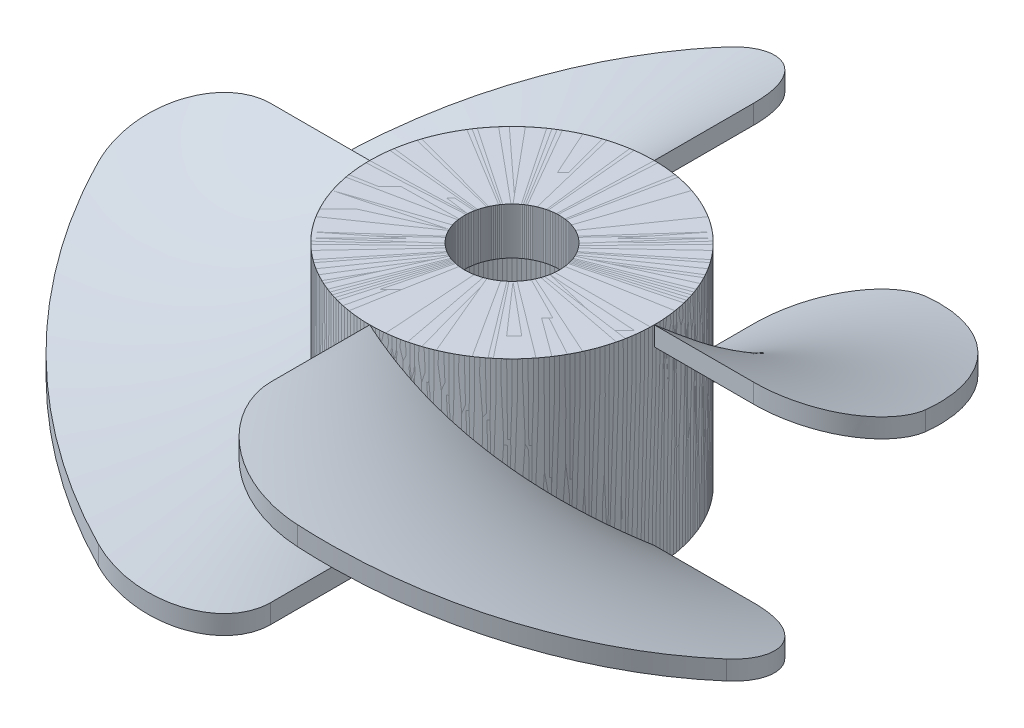
from build123d import *

# Parameters (mm, degrees)
SWEEP2_PITCH            = 80
SWEEP2_HEIGHT           = 20
SWEEP2_RADIUS           = 14.9
SWEEP2_START_ANGLE      = -90
SKETCH10_W              = 19.6
SKETCH10_H              = 2
BOSS_EXTRUDE1_START     = -1
BOSS_EXTRUDE1_DEPTH     = 22
FILLET6_R               = 8
CUT_EXTRUDE1_DEPTH      = 16.1
CUT_EXTRUDE1_DEPTH_BACK = 16.1
SKETCH13_3_R            = 12
SKETCH13_3_R_2          = 4.965
CUT_EXTRUDE3_DEPTH      = 1000
CUT_EXTRUDE3_DEPTH_BACK = 16.1
SKETCH13_4_R            = 4.965
CIRPATTERN1_COUNT       = 4


# Read off the part's stored shape, not the designer's step: Boss-Extrude1
with BuildPart() as part:
    # Sweep2: sweep along a helix
    with BuildLine() as sweep2_path:
        add(Helix(SWEEP2_PITCH, SWEEP2_HEIGHT, SWEEP2_RADIUS, center=(0, 0, 0), direction=(0, 1, 0), lefthand=True, mode=Mode.PRIVATE).rotate(Axis((0, 0, 0), (0, 1, 0)), SWEEP2_START_ANGLE))
    # Sketch10 → Sweep2 (sweep)
    with BuildSketch(Plane.XY):
        with Locations((-24.7, 0)):
            Rectangle(SKETCH10_W, SKETCH10_H)
    sweep(path=sweep2_path.line, is_frenet=True)

    # Boss-Extrude1 outline → Boss-Extrude1 (add)
    with BuildSketch(Plane(origin=(0, 0, 0), x_dir=(1, 0, 0), z_dir=(0, 1, 0)).offset(BOSS_EXTRUDE1_START)):
        with BuildLine():
            ThreePointArc((-14.9, 0), (10.53589104, -10.53589104), (0, 14.9))
            add(Edge.make_bspline(
                [(-14.9, 0), (-14.9, 1.46752191), (-14.613700678, 2.906845798), (-14.327401356, 4.346169686), (-13.765805034, 5.701983142), (-13.204208713, 7.057796598), (-12.388897223, 8.277996472), (-11.573585734, 9.498196346), (-10.53589104, 10.53589104), (-9.498196346, 11.573585734), (-8.277996472, 12.388897223), (-7.057796598, 13.204208713), (-5.701983142, 13.765805034), (-4.346169686, 14.327401356), (-2.906845798, 14.613700678), (-1.46752191, 14.9), (0, 14.9)],
                knots=[0, 0, 0, 0.03125, 0.03125, 0.0625, 0.0625, 0.09375, 0.09375, 0.125, 0.125, 0.15625, 0.15625, 0.1875, 0.1875, 0.21875, 0.21875, 0.25, 0.25, 0.25], degree=2, weights=[1, 0.995184727, 1, 0.995184727, 1, 0.995184727, 1, 0.995184727, 1, 0.995184727, 1, 0.995184727, 1, 0.995184727, 1, 0.995184727, 1]))
        make_face()
    extrude(amount=BOSS_EXTRUDE1_DEPTH)

    # Fillet6
    # the kernel refuses this fillet: 8 mm, written as the material it takes off along each edge
    with BuildSketch(Plane(origin=(-6.8e-08, 47.346838319, -34.499999889), x_dir=(3.4711469403176315e-09, -4.06254940799068e-09, 1.0), z_dir=(-6.750155989720952e-14, -1.0, -4.062549407990446e-09))) as fillet6_piece_1:
        with BuildLine():
            CenterArc((9.236381108, 8), FILLET6_R, 162.42909159, 107.57090841)
            ThreePointArc((1.609628536, 10.415086999), (0.40478119, 5.269367606), (0, 0))
            Line((0, 0), (9.236381108, 0))
        make_face()
    extrude(amount=54.693676478, mode=Mode.SUBTRACT)
    with BuildSketch(Plane(origin=(-34.5, 27.346838237, 0), x_dir=(0.15273449337234152, 3.511030608054098e-15, -0.9882672586574412), z_dir=(0, -1, 0))) as fillet6_piece_2:
        with BuildLine():
            CenterArc((9.316852034, 7.906136934), FILLET6_R, 171.214572142, 107.570908938)
            Line((1.410713965, 9.128012881), (0, 0))
            ThreePointArc((0, 0), (5.26936753, -0.404782189), (10.538735325, 0))
        make_face()
    extrude(amount=54.693676474, mode=Mode.SUBTRACT)

    # Sketch13<3> → Cut-Extrude1 (cut, two sides: drawn at the far end of the back side and taken through both)
    # profile 1 of 2: a face of its own
    with BuildSketch(Plane(origin=(0, 0, 0), x_dir=(1, 0, 0), z_dir=(0, 1, 0)).offset(-CUT_EXTRUDE1_DEPTH_BACK)):
        with Locations(Location((0, 0, 0), (0, 0, 270))):
            Circle(SKETCH13_3_R)
        Circle(SKETCH13_3_R_2, mode=Mode.SUBTRACT)
    # profile 2 of 2: a face of its own
    with BuildSketch(Plane(origin=(0, 0, 0), x_dir=(1, 0, 0), z_dir=(0, 1, 0)).offset(-CUT_EXTRUDE1_DEPTH_BACK)):
        Circle(SKETCH13_3_R_2)
    extrude(amount=CUT_EXTRUDE1_DEPTH + CUT_EXTRUDE1_DEPTH_BACK, mode=Mode.SUBTRACT)

    # Sketch13<4> → Cut-Extrude3 (cut, two sides: drawn at the far end of the back side and taken through both)
    with BuildSketch(Plane(origin=(0, 0, 0), x_dir=(1, 0, 0), z_dir=(0, 1, 0)).offset(-CUT_EXTRUDE3_DEPTH_BACK)):
        with Locations(Location((0, 0, 0), (0, 0, 270))):
            Circle(SKETCH13_4_R)
    extrude(amount=CUT_EXTRUDE3_DEPTH + CUT_EXTRUDE3_DEPTH_BACK, mode=Mode.SUBTRACT)


with BuildPart() as cirpattern1_1:
    # CirPattern1: pattern copy
    add(part.part.rotate(Axis((0, -1, 0), (0, 1, 0)), 1 * 360 / CIRPATTERN1_COUNT))


with BuildPart() as cirpattern1_2:
    # CirPattern1: pattern copy
    add(part.part.rotate(Axis((0, -1, 0), (0, 1, 0)), 2 * 360 / CIRPATTERN1_COUNT))


with BuildPart() as cirpattern1_3:
    # CirPattern1: pattern copy
    add(part.part.rotate(Axis((0, -1, 0), (0, 1, 0)), 3 * 360 / CIRPATTERN1_COUNT))


solid = Compound([part.part, cirpattern1_1.part, cirpattern1_2.part, cirpattern1_3.part])
